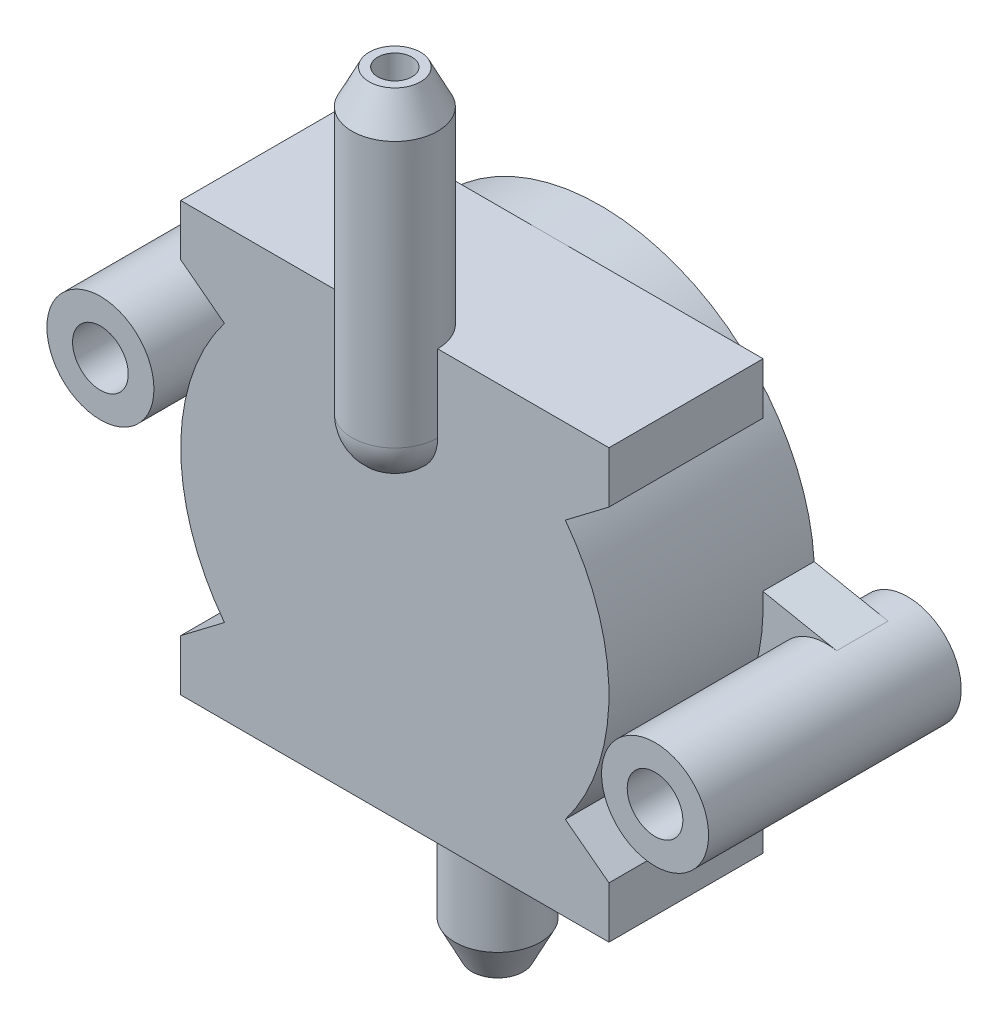
from build123d import *
from OCP.BRepFilletAPI import BRepFilletAPI_MakeChamfer
from build123d.topology import SkipClean

# Parameters (mm, degrees)
SALIENTE_EXTRUIR1_DEPTH      = 9
CROQUIS3_R                   = 1.344119186
SALIENTE_EXTRUIR2_DEPTH      = 1
CROQUIS4_R                   = 12.5
CROQUIS4_R_2                 = 1.444119186
SALIENTE_EXTRUIR3_DEPTH      = 3
CROQUIS5_R                   = 1.444119186
SALIENTE_EXTRUIR4_DEPTH      = 2
SALIENTE_EXTRUIR5_START      = -3
CROQUIS6_R                   = 1.625
SALIENTE_EXTRUIR5_DEPTH      = 3
CROQUIS7_R                   = 3.125
CROQUIS7_R_2                 = 1.625
SALIENTE_EXTRUIR6_DEPTH      = 1.75
CROQUIS8_R                   = 3.125
CROQUIS8_R_2                 = 1.625
SALIENTE_EXTRUIR7_DEPTH      = 10
SALIENTE_EXTRUIR8_DEPTH      = 13
SALIENTE_EXTRUIR8_DEPTH_BACK = 7
CROQUIS9_R                   = 2.5
REDONDEO1_R                  = 2.5
CROQUIS11_R                  = 2.5
CROQUIS11_R_2                = 1
SALIENTE_EXTRUIR9_DEPTH      = 10
CHAFL_N1_SIZE                = 2
CHAFL_N1_SIZE2               = 1
CROQUIS10_R                  = 1
CORTAR_EXTRUIR1_DEPTH        = 15


with BuildPart() as part:
    # Croquis2 → Saliente-Extruir1 (new body)
    with BuildSketch(Plane.XY):
        with BuildLine():
            Line((-12.5, 12.5), (12.5, 12.5))
            Line((12.5, 12.5), (12.5, 9.5))
            Line((12.5, 9.5), (9.952027427, 7.563540844))
            ThreePointArc((9.952027427, 7.563540844), (12.5, 0), (9.952027427, -7.563540844))
            Line((9.952027427, -7.563540844), (12.5, -9.5))
            Line((12.5, -9.5), (12.5, -12.5))
            Line((12.5, -12.5), (-12.5, -12.5))
            Line((-12.5, -12.5), (-12.5, -9.5))
            Line((-12.5, -9.5), (-9.952027427, -7.563540844))
            ThreePointArc((-9.952027427, -7.563540844), (-12.5, 0), (-9.952027427, 7.563540844))
            Line((-9.952027427, 7.563540844), (-12.5, 9.5))
            Line((-12.5, 9.5), (-12.5, 12.5))
        make_face()
    extrude(amount=SALIENTE_EXTRUIR1_DEPTH)

    # Croquis3 → Saliente-Extruir2 (add)
    with BuildSketch(Plane(origin=(0, 0, 0), x_dir=(-1, 0, 0), z_dir=(0, 0, -1))):
        Circle(CROQUIS3_R)
    extrude(amount=SALIENTE_EXTRUIR2_DEPTH)



with BuildPart() as body_2:
    # Croquis4 → Saliente-Extruir3 (new body)
    with BuildSketch(Plane(origin=(0, 0, 0), x_dir=(-1, 0, 0), z_dir=(0, 0, -1))):
        Circle(CROQUIS4_R)
        Circle(CROQUIS4_R_2, mode=Mode.SUBTRACT)
    extrude(amount=SALIENTE_EXTRUIR3_DEPTH)

    # Croquis5 → Saliente-Extruir4 (add)
    with BuildSketch(Plane(origin=(0, 0, -3), x_dir=(-1, 0, 0), z_dir=(0, 0, -1))):
        Circle(CROQUIS5_R)
    extrude(amount=-SALIENTE_EXTRUIR4_DEPTH)

    # Croquis6 → Saliente-Extruir5 (add)
    # profile 1 of 2: a face of its own
    with BuildSketch(Plane(origin=(0, 0, -3), x_dir=(-1, 0, 0), z_dir=(0, 0, -1)).offset(SALIENTE_EXTRUIR5_START)):
        with BuildLine():
            Line((-12.478662951, 0.73004859), (-16.792901594, -0.118663584))
            ThreePointArc((-16.792901594, -0.118663584), (-19.255933186, -3.788094791), (-15.586501979, -6.251126382))
            Line((-15.586501979, -6.251126382), (-11.272263337, -5.402414208))
            ThreePointArc((-11.272263337, -5.402414208), (-12.264925596, -2.41279923), (-12.478662951, 0.73004859))
        make_face()
        with Locations((-16.189701787, -3.184894983)):
            Circle(CROQUIS6_R, mode=Mode.SUBTRACT)
    # profile 2 of 2: a face of its own
    with BuildSketch(Plane(origin=(0, 0, -3), x_dir=(-1, 0, 0), z_dir=(0, 0, -1)).offset(SALIENTE_EXTRUIR5_START)):
        with BuildLine():
            Line((15.586501979, 6.251126382), (11.272263337, 5.402414208))
            ThreePointArc((11.272263337, 5.402414208), (12.264925596, 2.41279923), (12.478662951, -0.73004859))
            Line((12.478662951, -0.73004859), (16.792901594, 0.118663584))
            ThreePointArc((16.792901594, 0.118663584), (19.255933186, 3.788094791), (15.586501979, 6.251126382))
        make_face()
        with Locations((16.189701787, 3.184894983)):
            Circle(CROQUIS6_R, mode=Mode.SUBTRACT)
    extrude(amount=SALIENTE_EXTRUIR5_DEPTH)

    # Croquis7 → Saliente-Extruir6 (add)
    # profile 1 of 2: a face of its own
    with BuildSketch(Plane(origin=(0, 0, -3), x_dir=(-1, 0, 0), z_dir=(0, 0, -1))):
        with Locations((-16.189701787, -3.184894983)):
            Circle(CROQUIS7_R)
        with Locations((-16.189701787, -3.184894983)):
            Circle(CROQUIS7_R_2, mode=Mode.SUBTRACT)
    # profile 2 of 2: a face of its own
    with BuildSketch(Plane(origin=(0, 0, -3), x_dir=(-1, 0, 0), z_dir=(0, 0, -1))):
        with Locations((16.189701787, 3.184894983)):
            Circle(CROQUIS7_R)
        with Locations((16.189701787, 3.184894983)):
            Circle(CROQUIS7_R_2, mode=Mode.SUBTRACT)
    extrude(amount=SALIENTE_EXTRUIR6_DEPTH)

    # Croquis8 → Saliente-Extruir7 (add)
    # profile 1 of 2: a face of its own
    with SkipClean():  # the faces are left unmerged after this step: merging them gives an invalid solid
        with BuildSketch(Plane.XY):
            with Locations(Location((-16.189701787, 3.184894983, 0), (0, 0, 180))):
                Circle(CROQUIS8_R)
            with Locations(Location((-16.189701787, 3.184894983, 0), (0, 0, 180))):
                Circle(CROQUIS8_R_2, mode=Mode.SUBTRACT)
        # profile 2 of 2: a face of its own
        with BuildSketch(Plane.XY):
            with Locations(Location((16.189701787, -3.184894983, 0), (0, 0, 180))):
                Circle(CROQUIS8_R)
            with Locations(Location((16.189701787, -3.184894983, 0), (0, 0, 180))):
                Circle(CROQUIS8_R_2, mode=Mode.SUBTRACT)
        extrude(amount=SALIENTE_EXTRUIR7_DEPTH)


with BuildPart() as part_1:
    add(part.part)

    add(body_2.part)  # Saliente-Extruir8 merges body 2
    # Croquis9 → Saliente-Extruir8 (add, two sides: drawn at the far end of the back side and taken through both)
    with BuildSketch(Plane(origin=(0, 12.5, 0), x_dir=(1, 0, 0), z_dir=(0, 1, 0)).offset(-SALIENTE_EXTRUIR8_DEPTH_BACK)):
        with Locations(Location((0, -9, 0), (0, 0, 270))):
            Circle(CROQUIS9_R)
    extrude(amount=SALIENTE_EXTRUIR8_DEPTH + SALIENTE_EXTRUIR8_DEPTH_BACK)

    # Redondeo1
    redondeo1_edges = [part_1.edges().sort_by_distance(p)[0] for p in [
        (1.767766953, 5.5, 10.767766953),
    ]]
    fillet(redondeo1_edges, radius=REDONDEO1_R - 0.0001)  # a hair under: the kernel refuses the full size

    # Croquis11 → Saliente-Extruir9 (add)
    with BuildSketch(Plane.XZ.offset(12.5)):
        with Locations(Location((0, 3, 0), (0, 0, 90))):
            Circle(CROQUIS11_R)
        with Locations(Location((0, 3, 0), (0, 0, 270))):
            Circle(CROQUIS11_R_2, mode=Mode.SUBTRACT)
    extrude(amount=SALIENTE_EXTRUIR9_DEPTH)

    # Chaflán1: one chamfer whose edges measure the first distance from different faces: ONE call of the kernel's chamfer builder (chamfer() names one face for all edges)
    chafl_n1_edges_1 = [part_1.edges().sort_by_distance(p)[0] for p in [
        (0, 25.5, 6.5),
    ]]
    chafl_n1_side_1 = [part_1.faces().sort_by_distance(p)[0] for p in [
        (0, 19, 6.5),
    ]]
    chafl_n1_edges_2 = [part_1.edges().sort_by_distance(p)[0] for p in [
        (0, -22.5, 0.5),
    ]]
    chafl_n1_side_2 = [part_1.faces().sort_by_distance(p)[0] for p in [
        (0, -17.5, 0.5),
    ]]
    chafl_n1 = BRepFilletAPI_MakeChamfer(part_1.part.solid().wrapped)
    for e in chafl_n1_edges_1:
        chafl_n1.Add(CHAFL_N1_SIZE, CHAFL_N1_SIZE2, e.wrapped, chafl_n1_side_1[0].wrapped)  # the first distance lies on this face
    for e in chafl_n1_edges_2:
        chafl_n1.Add(CHAFL_N1_SIZE, CHAFL_N1_SIZE2, e.wrapped, chafl_n1_side_2[0].wrapped)  # the first distance lies on this face
    add(Compound.cast(chafl_n1.Shape()), mode=Mode.REPLACE)

    # Croquis10 → Cortar-Extruir1 (cut)
    with BuildSketch(Plane(origin=(0, 25.5, 0), x_dir=(1, 0, 0), z_dir=(0, 1, 0))):
        with Locations(Location((0, -9, 0), (0, 0, 270))):
            Circle(CROQUIS10_R)
    extrude(amount=-CORTAR_EXTRUIR1_DEPTH, mode=Mode.SUBTRACT)


solid = part_1.part
